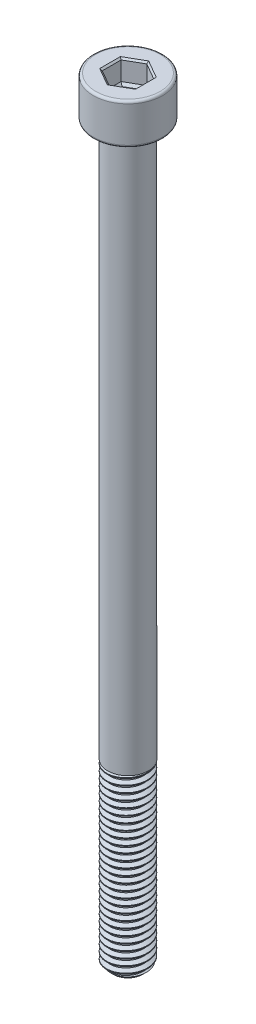
from build123d import *

# Parameters (mm, degrees)
SKETCH1_R           = 2.5
BOSS_EXTRUDE1_DEPTH = 22
THREAD1_PITCH       = 0.8
SKETCH2_R           = 2.5
BOSS_EXTRUDE2_DEPTH = 68
SKETCH3_R           = 4.25
BOSS_EXTRUDE3_DEPTH = 5
FILLET1_R           = 0.3
CUT_EXTRUDE1_DEPTH  = 2.5
CHAMFER1_SIZE       = 0.2
CUT_EXTRUDE2_DEPTH  = 0.3
CUT_EXTRUDE2_DRAFT  = -45


with BuildPart() as part:
    # Sketch1 → Boss-Extrude1 (new body)
    with BuildSketch(Plane(origin=(0, 0, 0), x_dir=(1, 0, 0), z_dir=(0, 1, 0))):
        with Locations(Location((0, 0, 0), (0, 0, 270))):
            Circle(SKETCH1_R)
    extrude(amount=BOSS_EXTRUDE1_DEPTH)

    # Thread1: arcs per turn and ends read off the stored shape
    # Thread1: the profile of Thread Profile1 profile screwed along a right-hand helix through 30 turns, 8 arcs to a turn; built about Z, then put on its axis
    thread1_z = Axis((0, 0, 0), (0, 0, 1))
    thread1_corners = [(2.5003, 0, -0.000173205), (2.5003, 0, 0.700173203), (2.0669873, 0, 0.449999999), (2.0669873, 0, 0.249999999)]
    with BuildLine(mode=Mode.PRIVATE) as thread1_profile:
        Line(thread1_corners[0], thread1_corners[1])
        Line(thread1_corners[1], thread1_corners[2])
        Line(thread1_corners[2], thread1_corners[3])
        Line(thread1_corners[3], thread1_corners[0])
    thread1_cap = Face(thread1_profile.wire())
    thread1_turn_angles = [0, 22.5, 45, 67.5, 90, 112.5, 135, 157.5, 180, 202.5, 225, 247.5, 270, 292.5, 315, 337.5, 360]
    thread1_turn_weights = [1, 0.9238795325112867, 1, 0.9238795325112867, 1, 0.9238795325112867, 1, 0.9238795325112867, 1, 0.9238795325112867, 1, 0.9238795325112867, 1, 0.9238795325112867, 1, 0.9238795325112867, 1]
    thread1_turn_rails = [Edge.make_bspline([Vector(p[0], p[1], 0).rotate(thread1_z, thread1_turn_angles[k]) / thread1_turn_weights[k] + Vector(0, 0, p[2] + THREAD1_PITCH * thread1_turn_angles[k] / 360) for k in range(17)], [0, 0, 0, 1, 1, 2, 2, 3, 3, 4, 4, 5, 5, 6, 6, 7, 7, 8, 8, 8], 2, thread1_turn_weights) for p in thread1_corners]
    thread1_turn_sides = [Face.make_surface_from_curves(thread1_turn_rails[p[0]], thread1_turn_rails[p[1]]) for p in [(0, 1), (1, 2), (2, 3), (3, 0)]]
    thread1 = Plane(origin=(0, 23, 0), x_dir=(-1, 0, 0), z_dir=(0, -1, 0)) * Solid(Shell([*[p.moved(Location((0, 0, THREAD1_PITCH * i))) for i in range(30) for p in thread1_turn_sides], thread1_cap, thread1_cap.rotate(thread1_z, 10800).moved(Location((0, 0, THREAD1_PITCH * 10800 / 360)))]))
    add(thread1, mode=Mode.SUBTRACT)

    # Sketch2 → Boss-Extrude2 (add)
    with BuildSketch(Plane(origin=(0, 22, 0), x_dir=(1, 0, 0), z_dir=(0, 1, 0))):
        with Locations(Location((0, 0, 0), (0, 0, 90))):
            Circle(SKETCH2_R)
    extrude(amount=BOSS_EXTRUDE2_DEPTH)

    # Sketch3 → Boss-Extrude3 (add)
    with BuildSketch(Plane(origin=(0, 90, 0), x_dir=(1, 0, 0), z_dir=(0, 1, 0))):
        with Locations(Location((0, 0, 0), (0, 0, 270))):
            Circle(SKETCH3_R)
    extrude(amount=BOSS_EXTRUDE3_DEPTH)

    # Fillet1
    fillet1_edges = [part.edges().sort_by_distance(p)[0] for p in [
        (0, 90, -4.25),
        (0, 95, -4.25),
    ]]
    fillet(fillet1_edges, radius=FILLET1_R)

    # Sketch4 → Cut-Revolve1 (revolve, cut)
    with BuildSketch(Plane.XY, mode=Mode.PRIVATE) as cut_revolve1_sk:
        Polygon((2.51, 0), (2.51, 0.7), (1.81, 0), align=None)
    revolve(cut_revolve1_sk.sketch.rotate(Axis((0, 0, 0), (0, 1, 0)), 90), axis=Axis((0, 0, 0), (0, 1, 0)), mode=Mode.SUBTRACT)

    # Sketch5 → Cut-Extrude1 (cut)
    with BuildSketch(Plane(origin=(0, 95, 0), x_dir=(1, 0, 0), z_dir=(0, 1, 0))):
        Polygon((0, 2.309401077), (-2, 1.154700538), (-2, -1.154700538), (0, -2.309401077), (2, -1.154700538), (2, 1.154700538), align=None)
    extrude(amount=-CUT_EXTRUDE1_DEPTH, mode=Mode.SUBTRACT)

    # Chamfer1
    chamfer1_edges = [part.edges().sort_by_distance(p)[0] for p in [
        (1, 95, -1.732050808),
        (-1, 95, -1.732050808),
        (-2, 95, 0),
        (-1, 95, 1.732050808),
        (1, 95, 1.732050808),
        (2, 95, 0),
    ]]
    chamfer(chamfer1_edges, length=CHAMFER1_SIZE)


with BuildPart() as cut_extrude2_tool:
    # Sketch6 → Cut-Extrude2 (with draft: the straight prism first)
    with BuildSketch(Plane(origin=(0, 92.5, 0), x_dir=(1, 0, 0), z_dir=(0, 1, 0))):
        Polygon((0, 2.309401077), (-2, 1.154700538), (-2, -1.154700538), (0, -2.309401077), (2, -1.154700538), (2, 1.154700538), align=None)
    extrude(amount=-CUT_EXTRUDE2_DEPTH)
    # Cut-Extrude2: the draft: its side faces are tilted about the plane it starts from
    cut_extrude2_sides = [cut_extrude2_tool.faces().sort_by_distance(p)[0] for p in [
        (-1, 92.35, -1.732050808),
        (-2, 92.35, 0),
        (-1, 92.35, 1.732050808),
        (1, 92.35, 1.732050808),
        (2, 92.35, 0),
        (1, 92.35, -1.732050808),
    ]]
    draft(cut_extrude2_sides, Plane(origin=(0, 92.5, 0), x_dir=(1, 0, 0), z_dir=(0, 1, 0)), CUT_EXTRUDE2_DRAFT)


with BuildPart() as part_1:
    add(part.part)

    # Cut-Extrude2: cut by cut_extrude2_tool
    add(cut_extrude2_tool.part, mode=Mode.SUBTRACT)


solid = part_1.part
